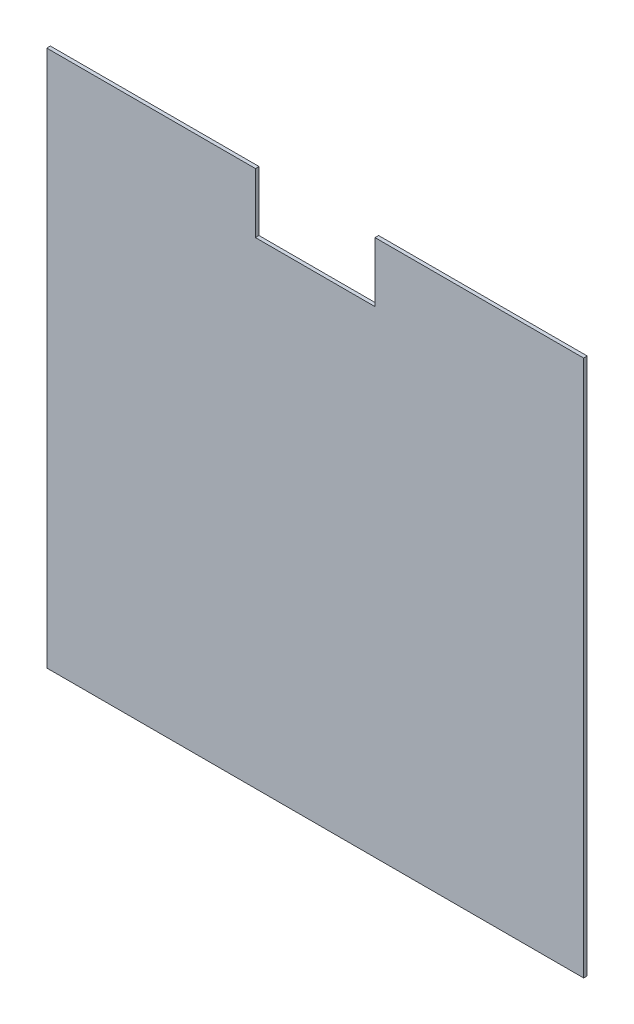
from build123d import *

# Parameters (mm, degrees)
ESTRUSIONE_ESTRUSIONE1_DEPTH = 3


with BuildPart() as part:
    # Schizzo1 → Estrusione-Estrusione1 (new body)
    with BuildSketch(Plane.XY):
        Polygon((0, 0), (0, 449), (174.5, 449), (174.5, 399), (274.5, 399), (274.5, 449), (449, 449), (449, 0), align=None)
    extrude(amount=ESTRUSIONE_ESTRUSIONE1_DEPTH)


solid = part.part
